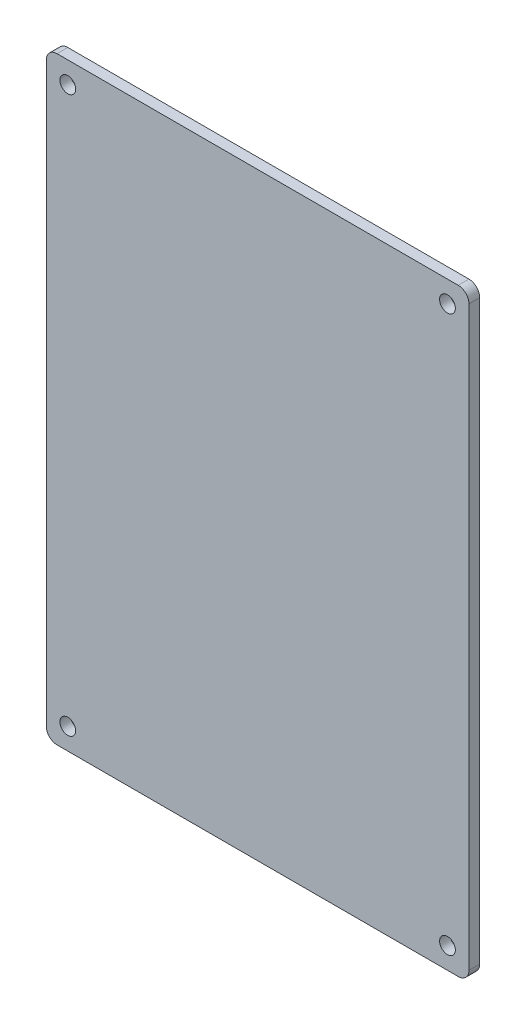
from build123d import *

# Parameters (mm, degrees)
LID_BASE_DEPTH = 1.5
INSERT_DEPTH   = 2
CONG_1_R       = 1
M3_HOLE_REACH  = 67.94
ESQUISSE5_R    = 1.1


with BuildPart() as part:
    # Esquisse3 → Lid_Base (new body)
    with BuildSketch(Plane.XY.offset(1)):
        with BuildLine():
            Line((-14.335501752, 46.874395923), (-14.335501752, -33.705604077))
            ThreePointArc((-14.335501752, -33.705604077), (-13.896161923, -34.766264249), (-12.835501752, -35.205604077))
            Line((-12.835501752, -35.205604077), (43.174498248, -35.205604077))
            ThreePointArc((43.174498248, -35.205604077), (44.23515842, -34.766264249), (44.674498248, -33.705604077))
            Line((44.674498248, -33.705604077), (44.674498248, 46.874395923))
            ThreePointArc((44.674498248, 46.874395923), (44.23515842, 47.935056095), (43.174498248, 48.374395923))
            Line((43.174498248, 48.374395923), (-12.835501752, 48.374395923))
            ThreePointArc((-12.835501752, 48.374395923), (-13.896161923, 47.935056095), (-14.335501752, 46.874395923))
        make_face()
    extrude(amount=LID_BASE_DEPTH)

    # Esquisse4 → Insert (add)
    with BuildSketch(Plane(origin=(0, 0, 1), x_dir=(-1, 0, 0), z_dir=(0, 0, -1))):
        with BuildLine():
            Line((7.335501752, 45.874395923), (-37.674498248, 45.874395923))
            ThreePointArc((-37.674498248, 45.874395923), (-38.38160503, 45.581502704), (-38.674498248, 44.874395923))
            Line((-38.674498248, 44.874395923), (-38.674498248, 43.874395923))
            ThreePointArc((-38.674498248, 43.874395923), (-39.113838077, 42.813735751), (-40.174498248, 42.374395923))
            Line((-40.174498248, 42.374395923), (-41.174498248, 42.374395923))
            ThreePointArc((-41.174498248, 42.374395923), (-41.88160503, 42.081502704), (-42.174498248, 41.374395923))
            Line((-42.174498248, 41.374395923), (-42.174498248, -28.205604077))
            ThreePointArc((-42.174498248, -28.205604077), (-41.88160503, -28.912710858), (-41.174498248, -29.205604077))
            Line((-41.174498248, -29.205604077), (-40.174498248, -29.205604077))
            ThreePointArc((-40.174498248, -29.205604077), (-39.113838077, -29.644943905), (-38.674498248, -30.705604077))
            Line((-38.674498248, -30.705604077), (-38.674498248, -31.705604077))
            ThreePointArc((-38.674498248, -31.705604077), (-38.38160503, -32.412710858), (-37.674498248, -32.705604077))
            Line((-37.674498248, -32.705604077), (7.335501752, -32.705604077))
            ThreePointArc((7.335501752, -32.705604077), (8.042608533, -32.412710858), (8.335501752, -31.705604077))
            Line((8.335501752, -31.705604077), (8.335501752, -30.705604077))
            ThreePointArc((8.335501752, -30.705604077), (8.77484158, -29.644943905), (9.835501752, -29.205604077))
            Line((9.835501752, -29.205604077), (10.835501752, -29.205604077))
            ThreePointArc((10.835501752, -29.205604077), (11.542608533, -28.912710858), (11.835501752, -28.205604077))
            Line((11.835501752, -28.205604077), (11.835501752, 41.374395923))
            ThreePointArc((11.835501752, 41.374395923), (11.542608533, 42.081502704), (10.835501752, 42.374395923))
            Line((10.835501752, 42.374395923), (9.835501752, 42.374395923))
            ThreePointArc((9.835501752, 42.374395923), (8.77484158, 42.813735751), (8.335501752, 43.874395923))
            Line((8.335501752, 43.874395923), (8.335501752, 44.874395923))
            ThreePointArc((8.335501752, 44.874395923), (8.042608533, 45.581502704), (7.335501752, 45.874395923))
        make_face()
        with BuildLine():
            Line((7.135501752, 44.674395923), (-37.474498248, 44.674395923))
            Line((-37.474498248, 44.674395923), (-37.474498248, 43.874395923))
            ThreePointArc((-37.474498248, 43.874395923), (-38.265309939, 41.965207614), (-40.174498248, 41.174395923))
            Line((-40.174498248, 41.174395923), (-40.974498248, 41.174395923))
            Line((-40.974498248, 41.174395923), (-40.974498248, -28.005604077))
            Line((-40.974498248, -28.005604077), (-40.174498248, -28.005604077))
            ThreePointArc((-40.174498248, -28.005604077), (-38.265309939, -28.796415768), (-37.474498248, -30.705604077))
            Line((-37.474498248, -30.705604077), (-37.474498248, -31.505604077))
            Line((-37.474498248, -31.505604077), (7.135501752, -31.505604077))
            Line((7.135501752, -31.505604077), (7.135501752, -30.705604077))
            ThreePointArc((7.135501752, -30.705604077), (7.926313442, -28.796415768), (9.835501752, -28.005604077))
            Line((9.835501752, -28.005604077), (10.635501752, -28.005604077))
            Line((10.635501752, -28.005604077), (10.635501752, 41.174395923))
            Line((10.635501752, 41.174395923), (9.835501752, 41.174395923))
            ThreePointArc((9.835501752, 41.174395923), (7.926313442, 41.965207614), (7.135501752, 43.874395923))
            Line((7.135501752, 43.874395923), (7.135501752, 44.674395923))
        make_face(mode=Mode.SUBTRACT)
    extrude(amount=INSERT_DEPTH)

    # Congé1
    # the kernel refuses this fillet: 1 mm, written as the material it adds along each edge
    with BuildSketch(Plane(origin=(-10.635501752, -28.005604077, 1), x_dir=(0, 0, -1), z_dir=(0, 1, 0)), Plane(origin=(40.974498248, 41.174395923, 1), x_dir=(0, 0, -1), z_dir=(0, -1, 0))) as cong_1_piece_1:
        with BuildLine():
            CenterArc((CONG_1_R, -CONG_1_R), CONG_1_R, 90, 90)
            Line((0, -CONG_1_R), (0, 0))
            Line((0, 0), (CONG_1_R, 0))
        make_face()
    extrude(amount=69.18)
    with BuildSketch(Plane(origin=(-9.835501752, -30.705604077, 1), x_dir=(1, 0, 0), z_dir=(0, -1, 0))) as cong_1_piece_2:
        with BuildLine():
            CenterArc((2.7 + CONG_1_R, -CONG_1_R), CONG_1_R, 90, 90)
            Line((2.7 + CONG_1_R, 0), (2.7, 0))
            Line((2.7, 0), (2.7, -CONG_1_R))
        make_face()
    revolve(axis=Axis((-9.835501752, -30.705604077, 1), (0, 0, 1)), revolution_arc=90)
    with BuildSketch(Plane(origin=(37.474498248, -31.505604077, 1), x_dir=(0, 0, -1), z_dir=(-1, 0, 0)), Plane(origin=(-7.135501752, 44.674395923, 1), x_dir=(0, 0, -1), z_dir=(1, 0, 0))) as cong_1_piece_3:
        with BuildLine():
            CenterArc((CONG_1_R, -CONG_1_R), CONG_1_R, 90, 90)
            Line((0, -CONG_1_R), (0, 0))
            Line((0, 0), (CONG_1_R, 0))
        make_face()
    extrude(amount=44.61)
    with BuildSketch(Plane(origin=(40.174498248, -30.705604077, 1), x_dir=(0, 1, 0), z_dir=(1, 0, 0))) as cong_1_piece_4:
        with BuildLine():
            CenterArc((2.7 + CONG_1_R, -CONG_1_R), CONG_1_R, 90, 90)
            Line((2.7 + CONG_1_R, 0), (2.7, 0))
            Line((2.7, 0), (2.7, -CONG_1_R))
        make_face()
    revolve(axis=Axis((40.174498248, -30.705604077, 1), (0, 0, 1)), revolution_arc=90)
    with BuildSketch(Plane(origin=(40.174498248, 43.874395923, 1), x_dir=(-1, 0, 0), z_dir=(0, 1, 0))) as cong_1_piece_5:
        with BuildLine():
            CenterArc((2.7 + CONG_1_R, -CONG_1_R), CONG_1_R, 90, 90)
            Line((2.7 + CONG_1_R, 0), (2.7, 0))
            Line((2.7, 0), (2.7, -CONG_1_R))
        make_face()
    revolve(axis=Axis((40.174498248, 43.874395923, 1), (0, 0, 1)), revolution_arc=90)
    with BuildSketch(Plane(origin=(-9.835501752, 43.874395923, 1), x_dir=(0, -1, 0), z_dir=(-1, 0, 0))) as cong_1_piece_6:
        with BuildLine():
            CenterArc((2.7 + CONG_1_R, -CONG_1_R), CONG_1_R, 90, 90)
            Line((2.7 + CONG_1_R, 0), (2.7, 0))
            Line((2.7, 0), (2.7, -CONG_1_R))
        make_face()
    revolve(axis=Axis((-9.835501752, 43.874395923, 1), (0, 0, 1)), revolution_arc=90)
    with BuildSketch(Plane(origin=(-10.635501752, 41.174395923, 1), x_dir=(0, 0, -1), z_dir=(1, 0, 0)), Plane(origin=(-7.135501752, 43.874395923, 1), x_dir=(0, 0, -1), z_dir=(0, 1, 0)), Plane(origin=(37.474498248, 44.674395923, 1), x_dir=(0, 0, -1), z_dir=(0, -1, 0)), Plane(origin=(40.174498248, 41.174395923, 1), x_dir=(0, 0, -1), z_dir=(1, 0, 0)), Plane(origin=(40.974498248, -28.005604077, 1), x_dir=(0, 0, -1), z_dir=(-1, 0, 0)), Plane(origin=(37.474498248, -30.705604077, 1), x_dir=(0, 0, -1), z_dir=(0, -1, 0)), Plane(origin=(-7.135501752, -31.505604077, 1), x_dir=(0, 0, -1), z_dir=(0, 1, 0)), Plane(origin=(-9.835501752, -28.005604077, 1), x_dir=(0, 0, -1), z_dir=(-1, 0, 0))) as cong_1_piece_7:
        with BuildLine():
            CenterArc((CONG_1_R, -CONG_1_R), CONG_1_R, 90, 90)
            Line((0, -CONG_1_R), (0, 0))
            Line((0, 0), (CONG_1_R, 0))
        make_face()
    extrude(amount=0.8)

    # Esquisse5 → M3_Hole (cut, up to next)
    with BuildSketch(Plane.XY.offset(2.5), mode=Mode.PRIVATE) as m3_hole_sk1:
        with Locations((-11.335501752, -32.205604077)):
            Circle(ESQUISSE5_R)
    m3_hole_tool1 = extrude(m3_hole_sk1.sketch, amount=-M3_HOLE_REACH, mode=Mode.PRIVATE) & part.part
    # Esquisse5 → M3_Hole (cut, up to next)
    with BuildSketch(Plane.XY.offset(2.5), mode=Mode.PRIVATE) as m3_hole_sk2:
        with Locations((-11.335501752, 45.374395923)):
            Circle(ESQUISSE5_R)
    m3_hole_tool2 = extrude(m3_hole_sk2.sketch, amount=-M3_HOLE_REACH, mode=Mode.PRIVATE) & part.part
    # Esquisse5 → M3_Hole (cut, up to next)
    with BuildSketch(Plane.XY.offset(2.5), mode=Mode.PRIVATE) as m3_hole_sk3:
        with Locations((41.674498248, 45.374395923)):
            Circle(ESQUISSE5_R)
    m3_hole_tool3 = extrude(m3_hole_sk3.sketch, amount=-M3_HOLE_REACH, mode=Mode.PRIVATE) & part.part
    # Esquisse5 → M3_Hole (cut, up to next)
    with BuildSketch(Plane.XY.offset(2.5), mode=Mode.PRIVATE) as m3_hole_sk4:
        with Locations((41.674498248, -32.205604077)):
            Circle(ESQUISSE5_R)
    m3_hole_tool4 = extrude(m3_hole_sk4.sketch, amount=-M3_HOLE_REACH, mode=Mode.PRIVATE) & part.part
    add(m3_hole_tool1.solids().sort_by_distance((-11.335502, -32.205604, 2.5))[0], mode=Mode.SUBTRACT)
    add(m3_hole_tool2.solids().sort_by_distance((-11.335502, 45.374396, 2.5))[0], mode=Mode.SUBTRACT)
    add(m3_hole_tool3.solids().sort_by_distance((41.674498, 45.374396, 2.5))[0], mode=Mode.SUBTRACT)
    add(m3_hole_tool4.solids().sort_by_distance((41.674498, -32.205604, 2.5))[0], mode=Mode.SUBTRACT)


solid = part.part
